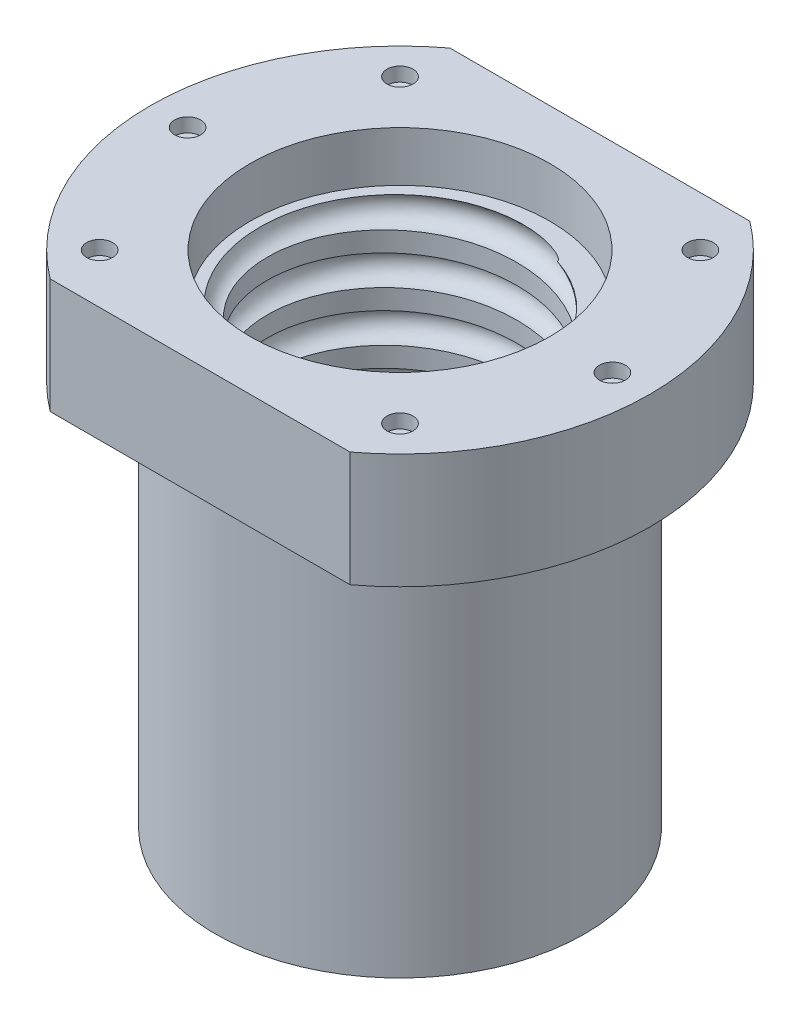
from build123d import *

# Parameters (mm, degrees)
CUT_EXTRUDE2_DEPTH      = 62.23724357
CUT_EXTRUDE2_DEPTH_BACK = 62.23724357
CUT_EXTRUDE3_DEPTH      = 60.371710435
CUT_EXTRUDE3_DEPTH_BACK = 60.371710435
SKETCH4_R               = 0.7
SKETCH6_R               = 1.3
CUT_EXTRUDE4_DEPTH      = 1.4
CUT_SWEEP1_PITCH        = 5


with BuildPart() as part:
    # Sketch1 → Revolve1 (revolve)
    with BuildSketch(Plane.XY, mode=Mode.PRIVATE) as revolve1_sk:
        Polygon((-15, 98.122252054), (-25, 98.122252054), (-25, 86.622252054), (-18.5, 86.622252054), (-18.5, 48.122252054), (-16, 48.122252054), (-16, 53.122252054), (-12.5, 53.122252054), (-12.5, 93.122252054), (-15, 93.122252054), align=None)
    revolve(revolve1_sk.sketch.rotate(Axis((0, -128.533582024, 0), (0, 1, 0)), 180), axis=Axis((0, -128.533582024, 0), (0, 1, 0)))

    # Sketch3 → Cut-Extrude2 (cut, two sides: drawn at the far end of the back side and taken through both)
    with BuildSketch(Plane(origin=(0, 98.122252054, 0), x_dir=(1, 0, 0), z_dir=(0, 1, 0)).offset(-CUT_EXTRUDE2_DEPTH_BACK)):
        with BuildLine():
            Line((-16.613247726, -20), (16.613247726, -20))
            ThreePointArc((16.613247726, -20), (0, -26), (-16.613247726, -20))
        make_face()
        with BuildLine():
            Line((-16.613247726, 20), (16.613247726, 20))
            ThreePointArc((16.613247726, 20), (0, 26), (-16.613247726, 20))
        make_face()
    extrude(amount=CUT_EXTRUDE2_DEPTH + CUT_EXTRUDE2_DEPTH_BACK, mode=Mode.SUBTRACT)

    # Sketch4 → Cut-Extrude3 (cut, two sides: drawn at the far end of the back side and taken through both)
    with BuildSketch(Plane(origin=(0, 98.122252054, 0), x_dir=(1, 0, 0), z_dir=(0, 1, 0)).offset(-CUT_EXTRUDE3_DEPTH_BACK)):
        with Locations(Location((-21.25, 0, 0), (0, 0, 180))):
            Circle(SKETCH4_R)
        with Locations(Location((-15.0260191, 15.0260191, 0), (0, 0, 180))):
            Circle(SKETCH4_R)
        with Locations(Location((15.0260191, 15.0260191, 0), (0, 0, 180))):
            Circle(SKETCH4_R)
        with Locations(Location((21.25, 0, 0), (0, 0, 180))):
            Circle(SKETCH4_R)
        with Locations(Location((15.0260191, -15.0260191, 0), (0, 0, 180))):
            Circle(SKETCH4_R)
        with Locations(Location((-15.0260191, -15.0260191, 0), (0, 0, 180))):
            Circle(SKETCH4_R)
    extrude(amount=CUT_EXTRUDE3_DEPTH + CUT_EXTRUDE3_DEPTH_BACK, mode=Mode.SUBTRACT)

    # Sketch6 → Cut-Extrude4 (cut)
    with BuildSketch(Plane(origin=(0, 98.122252054, 0), x_dir=(1, 0, 0), z_dir=(0, 1, 0))):
        with Locations(Location((-21.25, 0, 0), (0, 0, 180))):
            Circle(SKETCH6_R)
        with Locations(Location((-15.0260191, 15.0260191, 0), (0, 0, 180))):
            Circle(SKETCH6_R)
        with Locations(Location((15.0260191, 15.0260191, 0), (0, 0, 180))):
            Circle(SKETCH6_R)
        with Locations(Location((21.25, 0, 0), (0, 0, 180))):
            Circle(SKETCH6_R)
        with Locations(Location((15.0260191, -15.0260191, 0), (0, 0, 180))):
            Circle(SKETCH6_R)
        with Locations(Location((-15.0260191, -15.0260191, 0), (0, 0, 180))):
            Circle(SKETCH6_R)
    extrude(amount=-CUT_EXTRUDE4_DEPTH, mode=Mode.SUBTRACT)

    # Cut-Sweep1: arcs per turn and ends read off the stored shape
    # Cut-Sweep1: the profile of Sketch8 screwed along a right-hand helix through 11 turns, 12 arcs to a turn; built about Z, then put on its axis
    cut_sweep1_z = Axis((0, 0, 0), (0, 0, 1))
    cut_sweep1_corners = [(11, 0, -5), (12.5, 0, -6.5), (14, 0, -5), (12.5, 0, -3.5)]
    with BuildLine(mode=Mode.PRIVATE) as cut_sweep1_profile:
        ThreePointArc((11, 0, -5), (11.439339828, 0, -6.060660172), (12.5, 0, -6.5))
        ThreePointArc((12.5, 0, -6.5), (13.560660172, 0, -6.060660172), (14, 0, -5))
        ThreePointArc((14, 0, -5), (13.560660172, 0, -3.939339828), (12.5, 0, -3.5))
        ThreePointArc((12.5, 0, -3.5), (11.439339828, 0, -3.939339828), (11, 0, -5))
    cut_sweep1_cap = Face(cut_sweep1_profile.wire())
    cut_sweep1_arcs = [((11, 0, -5), (11, 0, -6.5), (12.5, 0, -6.5), (1, 0.7071067811865476, 1)), ((12.5, 0, -6.5), (14, 0, -6.5), (14, 0, -5), (1, 0.7071067811865476, 1)), ((14, 0, -5), (14, 0, -3.5), (12.5, 0, -3.5), (1, 0.7071067811865476, 1)), ((12.5, 0, -3.5), (11, 0, -3.5), (11, 0, -5), (1, 0.7071067811865476, 1))]  # start, shoulder, end, weights
    cut_sweep1_turn_angles = [0, 15, 30, 45, 60, 75, 90, 105, 120, 135, 150, 165, 180, 195, 210, 225, 240, 255, 270, 285, 300, 315, 330, 345, 360]
    cut_sweep1_turn_weights = [1, 0.9659258262890683, 1, 0.9659258262890683, 1, 0.9659258262890683, 1, 0.9659258262890683, 1, 0.9659258262890683, 1, 0.9659258262890683, 1, 0.9659258262890683, 1, 0.9659258262890683, 1, 0.9659258262890683, 1, 0.9659258262890683, 1, 0.9659258262890683, 1, 0.9659258262890683, 1]
    cut_sweep1_turn_sides = [Face.make_bezier_surface([[Vector(p[j][0], p[j][1], 0).rotate(cut_sweep1_z, cut_sweep1_turn_angles[2 * i + k]) / cut_sweep1_turn_weights[2 * i + k] + Vector(0, 0, p[j][2] + CUT_SWEEP1_PITCH * cut_sweep1_turn_angles[2 * i + k] / 360) for k in range(3)] for j in range(3)], [[p[3][j] * cut_sweep1_turn_weights[2 * i + k] for k in range(3)] for j in range(3)]) for p in cut_sweep1_arcs for i in range(12)]
    cut_sweep1 = Plane(origin=(0, 93.122252054, 0), x_dir=(-1, 0, 0), z_dir=(0, -1, 0)) * Solid(Shell([*[p.moved(Location((0, 0, CUT_SWEEP1_PITCH * i))) for i in range(11) for p in cut_sweep1_turn_sides], cut_sweep1_cap, cut_sweep1_cap.rotate(cut_sweep1_z, 3960).moved(Location((0, 0, CUT_SWEEP1_PITCH * 3960 / 360)))]))
    add(cut_sweep1, mode=Mode.SUBTRACT)


solid = part.part
